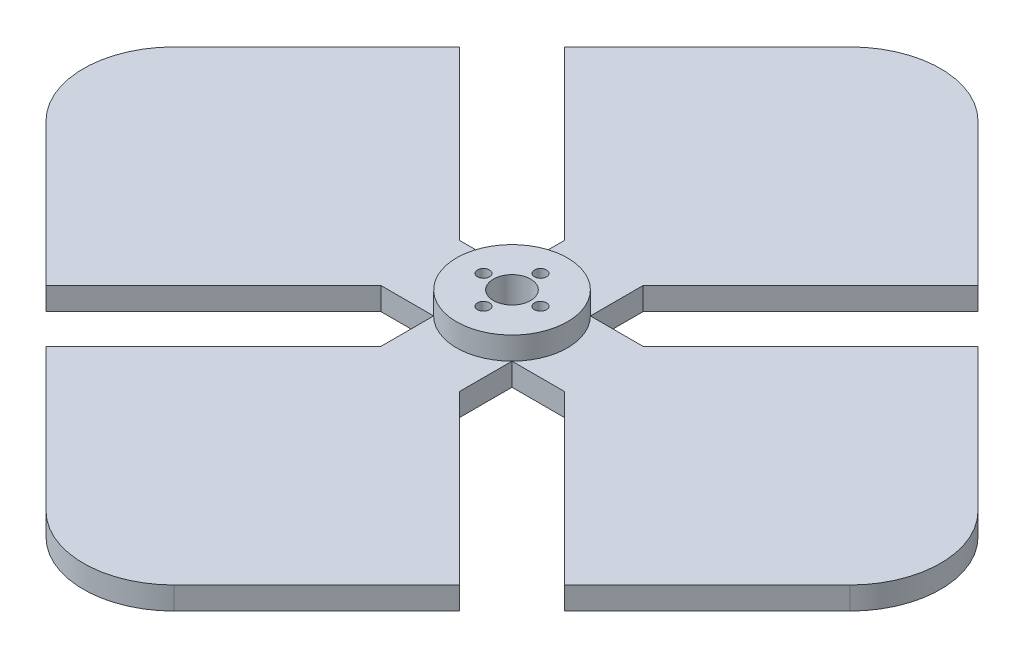
from build123d import *

# Parameters (mm, degrees)
BOSS_EXTRUDE5_DEPTH      = 6.35
FILLET1_R                = 25.4
CIRPATTERN7_COUNT        = 4
FILLET1_OF_CIRPATTERN7_R = 25.4
SKETCH13_R               = 15.556349186
BOSS_EXTRUDE8_DEPTH      = 6.35
SKETCH1_R                = 5.22699996
SKETCH1_R_2              = 1.686500056
CUT_EXTRUDE1_DEPTH       = 171.602385301


with BuildPart() as part:
    # Sketch4 → Boss-Extrude5 (new body)
    with BuildSketch(Plane(origin=(0, 0, 0), x_dir=(1, 0, 0), z_dir=(0, 1, 0))):
        Polygon((25.7955, 11), (0, 11), (0, -11), (25.7955, -11), (72.807954542, -58.012454542), (130.820409084, 0), (72.807954542, 58.012454542), align=None)
    boss_extrude5 = extrude(amount=BOSS_EXTRUDE5_DEPTH)

    # Fillet1
    fillet1_edges = [part.edges().sort_by_distance(p)[0] for p in [
        (130.820409084, 3.175, 0),
    ]]
    fillet(fillet1_edges, radius=FILLET1_R)

    # CirPattern7: Boss-Extrude5 ×4 about axis
    cirpattern7_axis = Axis((0, 0, 0), (0, 1, 0))
    for i in range(1, CIRPATTERN7_COUNT):
        add(boss_extrude5.rotate(cirpattern7_axis, i * 360 / CIRPATTERN7_COUNT))

    # Fillet1 of CirPattern7
    fillet1_of_cirpattern7_edges = [part.edges().sort_by_distance(p)[0] for p in [
        (0, 3.175, -130.820409084),
        (-130.820409084, 3.175, 0),
        (0, 3.175, 130.820409084),
    ]]
    fillet(fillet1_of_cirpattern7_edges, radius=FILLET1_OF_CIRPATTERN7_R)

    # Sketch13 → Boss-Extrude8 (add)
    with BuildSketch(Plane(origin=(0, 6.35, 0), x_dir=(1, 0, 0), z_dir=(0, 1, 0))):
        Circle(SKETCH13_R)
    extrude(amount=BOSS_EXTRUDE8_DEPTH)

    # Sketch1 → Cut-Extrude1 (cut, through all)
    with BuildSketch(Plane(origin=(0, 0, 0), x_dir=(1, 0, 0), z_dir=(0, 1, 0))):
        Circle(SKETCH1_R)
        with Locations((8.000000002, 0)):
            Circle(SKETCH1_R_2)
        with Locations((0, -8.000000002)):
            Circle(SKETCH1_R_2)
        with Locations((-8.000000002, 0)):
            Circle(SKETCH1_R_2)
        with Locations((0, 8.000000002)):
            Circle(SKETCH1_R_2)
    extrude(amount=CUT_EXTRUDE1_DEPTH, mode=Mode.SUBTRACT)


solid = part.part
